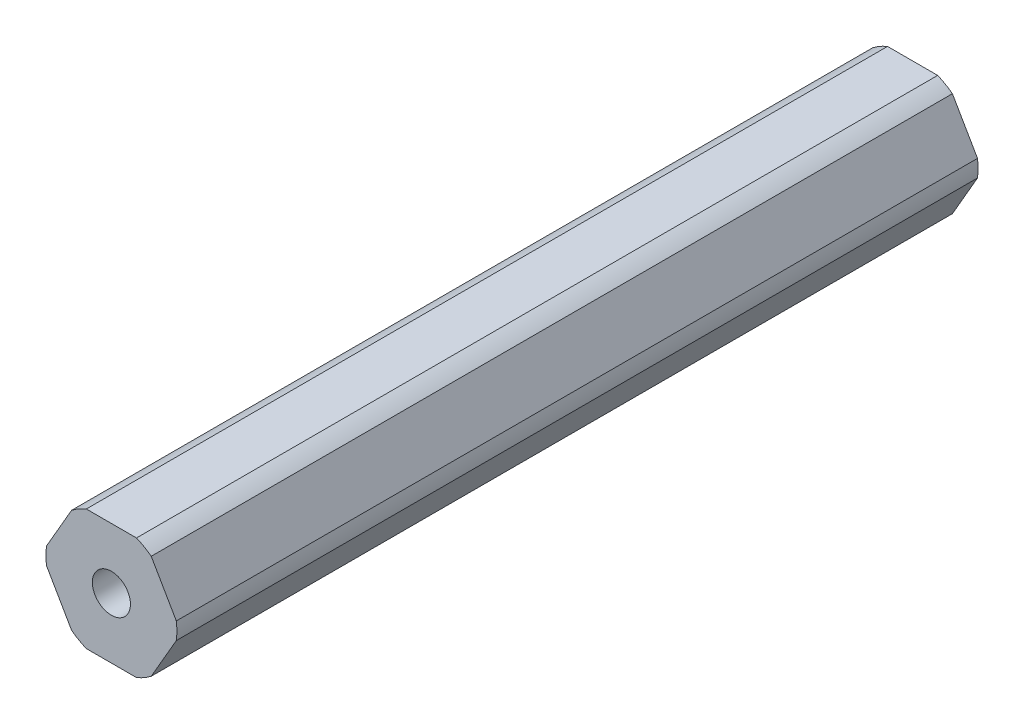
from build123d import *

# Parameters (mm, degrees)
SKETCH1_R           = 2.000000064
BOSS_EXTRUDE1_DEPTH = 42.06875


with BuildPart() as part:
    # Sketch1 → Boss-Extrude1 (new, symmetric)
    with BuildSketch(Plane.XY):
        with BuildLine():
            ThreePointArc((4.181770846, 5.456960429), (3.437499983, 5.953924622), (2.634980936, 6.35))
            Line((2.634980936, 6.35), (-2.634980936, 6.35))
            ThreePointArc((-2.634980936, 6.35), (-3.437499983, 5.953924622), (-4.181770846, 5.456960429))
            Line((-4.181770846, 5.456960429), (-6.816751782, 0.893039571))
            ThreePointArc((-6.816751782, 0.893039571), (-6.874999966, 0), (-6.816751782, -0.893039571))
            Line((-6.816751782, -0.893039571), (-4.181770846, -5.456960429))
            ThreePointArc((-4.181770846, -5.456960429), (-3.437499983, -5.953924622), (-2.634980936, -6.35))
            Line((-2.634980936, -6.35), (2.634980936, -6.35))
            ThreePointArc((2.634980936, -6.35), (3.437499983, -5.953924622), (4.181770846, -5.456960429))
            Line((4.181770846, -5.456960429), (6.816751782, -0.893039571))
            ThreePointArc((6.816751782, -0.893039571), (6.860422465, -0.447468582), (6.874999966, 0))
            ThreePointArc((6.874999966, 0), (6.860422465, 0.447468582), (6.816751782, 0.893039571))
            Line((6.816751782, 0.893039571), (4.181770846, 5.456960429))
        make_face()
        Circle(SKETCH1_R, mode=Mode.SUBTRACT)
    extrude(amount=BOSS_EXTRUDE1_DEPTH, both=True)


solid = part.part
